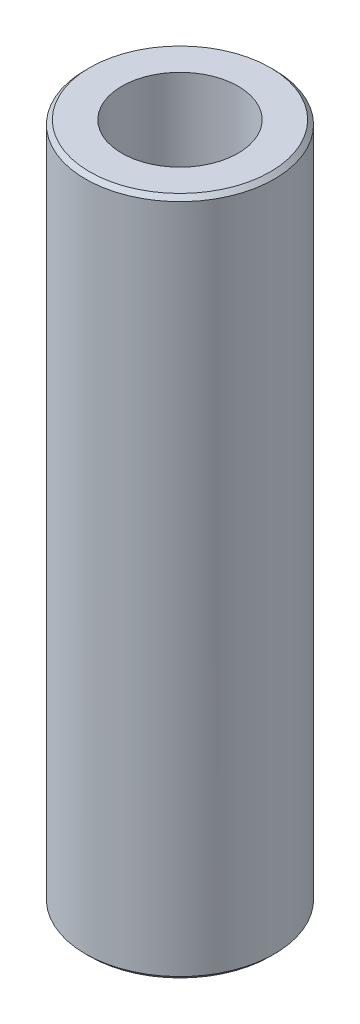
from build123d import *

# Parameters (mm, degrees)
SKETCH1_R           = 15
BOSS_EXTRUDE1_DEPTH = 107.881599516
SKETCH2_R           = 9.229905233
CUT_EXTRUDE1_DEPTH  = 110.94743978
CHAMFER1_SIZE       = 0.661348556


with BuildPart() as part:
    # Sketch1 → Boss-Extrude1 (new body)
    with BuildSketch(Plane(origin=(0, 0, 0), x_dir=(1, 0, 0), z_dir=(0, 1, 0))):
        Circle(SKETCH1_R)
    extrude(amount=BOSS_EXTRUDE1_DEPTH)

    # Sketch2 → Cut-Extrude1 (cut, through all)
    with BuildSketch(Plane(origin=(0, 0, 0), x_dir=(1, 0, 0), z_dir=(0, 1, 0))):
        Circle(SKETCH2_R)
    extrude(amount=CUT_EXTRUDE1_DEPTH, mode=Mode.SUBTRACT)

    # Chamfer1
    chamfer1_edges = [part.edges().sort_by_distance(p)[0] for p in [
        (-15, 107.881599516, 0),
        (-15, 0, 0),
    ]]
    chamfer(chamfer1_edges, length=CHAMFER1_SIZE)


solid = part.part
